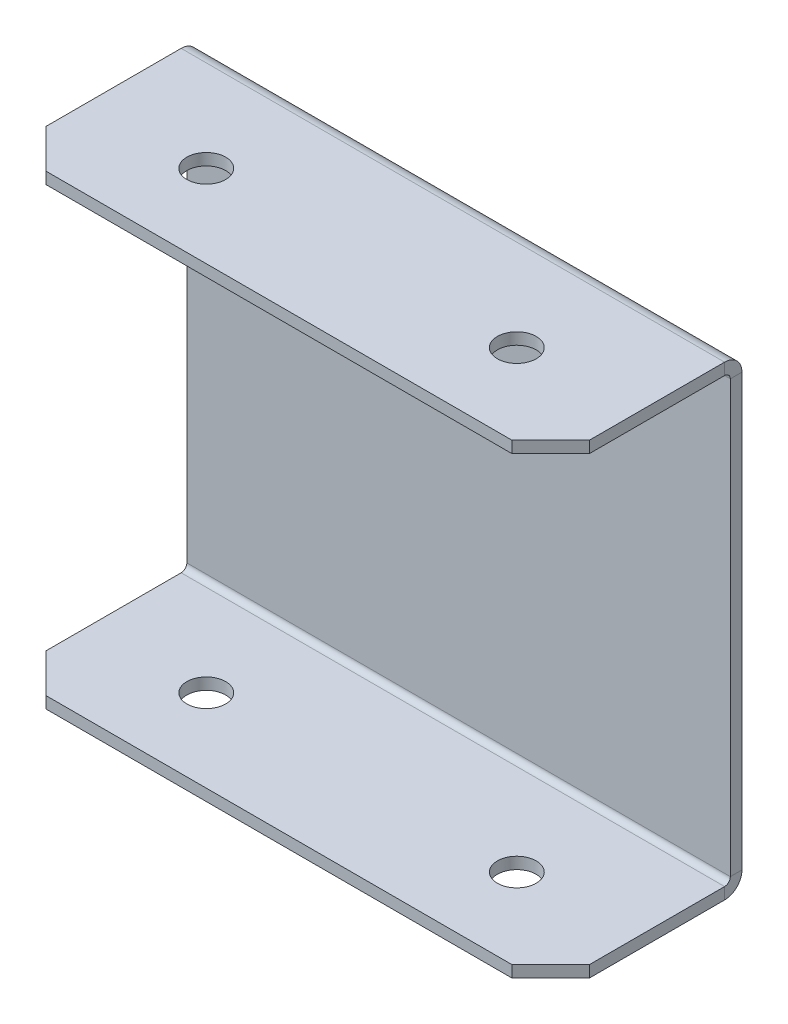
from build123d import *

# Parameters (mm, degrees)
BASE_FLANGE1_DEPTH     = 1.5
SKETCHED_START         = -35
SKETCHED_BEND1_DEPTH   = 70
SKETCHED_BEND1_2_DEPTH = 70
CHAMFER1_SIZE          = 5
SKETCH7_R              = 2.5
CUT_EXTRUDE1_DEPTH     = 74.21454467


# Read off the part's stored shape, not the designer's step: Sketched Bend1
# Sheet-metal steps are written as plain solids
with BuildPart() as part:
    # Sketch1 → Base-Flange1 (new body)
    with BuildSketch(Plane(origin=(0, 0, 0), x_dir=(0, 1, 0), z_dir=(0, 0, 1))):
        Polygon((-30, -35), (30, -35), (52.5, -35), (52.5, 35), (30, 35), (-30, 35), (-52.5, 35), (-52.5, -35), align=None)
    extrude(amount=-BASE_FLANGE1_DEPTH)

    # Sketched Bend1 outline → Sketched Bend1 (cut)
    with BuildSketch(Plane.YZ.offset(SKETCHED_START)):
        with BuildLine():
            ThreePointArc((29.875223856, 0), (29.058564082, -1.086838938), (27.7634, -1.5))
            Line((27.7634, -1.5), (52.5, -1.5))
            Line((52.5, -1.5), (52.5, 0))
            Line((52.5, 0), (29.875223856, 0))
        make_face()
        with BuildLine():
            Line((-52.5, -1.5), (-27.7634, -1.5))
            ThreePointArc((-27.7634, -1.5), (-29.058564082, -1.086838938), (-29.875223856, 0))
            Line((-29.875223856, 0), (-52.5, 0))
            Line((-52.5, 0), (-52.5, -1.5))
        make_face()
    extrude(amount=SKETCHED_BEND1_DEPTH, mode=Mode.SUBTRACT)

    # Sketched Bend1 2 outline → Sketched Bend1 2 (add)
    with BuildSketch(Plane.YZ.offset(SKETCHED_START)):
        with BuildLine():
            Line((27.7634, 0), (29.875223856, 0))
            ThreePointArc((29.875223856, 0), (29.968585343, 0.363053267), (30, 0.7366))
            Line((30, 0.7366), (30, 23.138054181))
            Line((30, 23.138054181), (28.5, 23.138054181))
            Line((28.5, 23.138054181), (28.5, 0.7366))
            ThreePointArc((28.5, 0.7366), (28.284254855, 0.215745145), (27.7634, 0))
        make_face()
        with BuildLine():
            ThreePointArc((-30, 0.7366), (-29.968585343, 0.363053267), (-29.875223856, 0))
            Line((-29.875223856, 0), (-27.7634, 0))
            ThreePointArc((-27.7634, 0), (-28.284254855, 0.215745145), (-28.5, 0.7366))
            Line((-28.5, 0.7366), (-28.5, 23.138054181))
            Line((-28.5, 23.138054181), (-30, 23.138054181))
            Line((-30, 23.138054181), (-30, 0.7366))
        make_face()
    extrude(amount=SKETCHED_BEND1_2_DEPTH)

    # Chamfer1
    chamfer1_edges = [part.edges().sort_by_distance(p)[0] for p in [
        (35, -29.25, 23.138054181),
        (-35, -29.25, 23.138054181),
        (-35, 29.25, 23.138054181),
        (35, 29.25, 23.138054181),
    ]]
    chamfer(chamfer1_edges, length=CHAMFER1_SIZE)

    # Sketch7 → Cut-Extrude1 (cut, through all)
    with BuildSketch(Plane(origin=(0, 30, 0), x_dir=(-1, 0, 0), z_dir=(0, 1, 0))):
        with Locations(Location((-20, 12.5, 0), (0, 0, 90))):
            Circle(SKETCH7_R)
        with Locations(Location((20, 12.5, 0), (0, 0, 90))):
            Circle(SKETCH7_R)
    extrude(amount=-CUT_EXTRUDE1_DEPTH, mode=Mode.SUBTRACT)


solid = part.part
